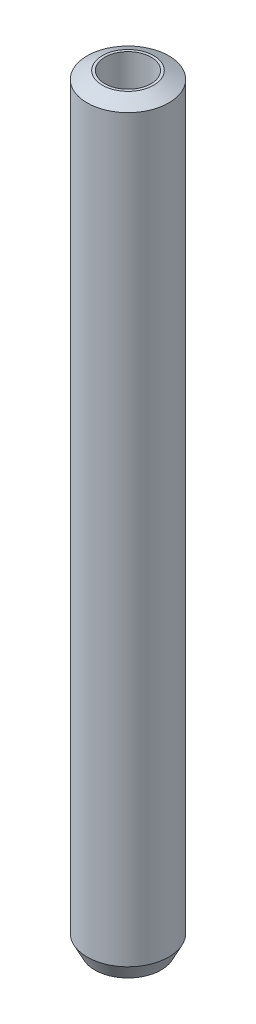
from build123d import *
from OCP.BRepFilletAPI import BRepFilletAPI_MakeChamfer

# Parameters (mm, degrees)
SKETCH1_R           = 15
BOSS_EXTRUDE1_DEPTH = 280.133795395
SKETCH2_R           = 8.475551566
CUT_EXTRUDE1_DEPTH  = 281.935834885
CHAMFER1_SIZE       = 2.832846096
CHAMFER1_SIZE2      = 5.567812545


with BuildPart() as part:
    # Sketch1 → Boss-Extrude1 (new body)
    with BuildSketch(Plane(origin=(0, 0, 0), x_dir=(1, 0, 0), z_dir=(0, 1, 0))):
        Circle(SKETCH1_R)
    extrude(amount=BOSS_EXTRUDE1_DEPTH)

    # Sketch2 → Cut-Extrude1 (cut, through all)
    with BuildSketch(Plane(origin=(0, 0, 0), x_dir=(1, 0, 0), z_dir=(0, 1, 0))):
        Circle(SKETCH2_R)
    extrude(amount=CUT_EXTRUDE1_DEPTH, mode=Mode.SUBTRACT)

    # Chamfer1: one chamfer whose edges measure the first distance from different faces: ONE call of the kernel's chamfer builder (chamfer() names one face for all edges)
    chamfer1_edges_1 = [part.edges().sort_by_distance(p)[0] for p in [
        (-15, 280.133795395, 0),
    ]]
    chamfer1_side_1 = [part.faces().sort_by_distance(p)[0] for p in [
        (-15, 140.066897698, 0),
    ]]
    chamfer1_edges_2 = [part.edges().sort_by_distance(p)[0] for p in [
        (-15, 0, 0),
    ]]
    chamfer1_side_2 = [part.faces().sort_by_distance(p)[0] for p in [
        (-14.575735931, 0, 0),
    ]]
    chamfer1 = BRepFilletAPI_MakeChamfer(part.part.solid().wrapped)
    for e in chamfer1_edges_1:
        chamfer1.Add(CHAMFER1_SIZE, CHAMFER1_SIZE2, e.wrapped, chamfer1_side_1[0].wrapped)  # the first distance lies on this face
    for e in chamfer1_edges_2:
        chamfer1.Add(CHAMFER1_SIZE, CHAMFER1_SIZE2, e.wrapped, chamfer1_side_2[0].wrapped)  # the first distance lies on this face
    add(Compound.cast(chamfer1.Shape()), mode=Mode.REPLACE)


solid = part.part
